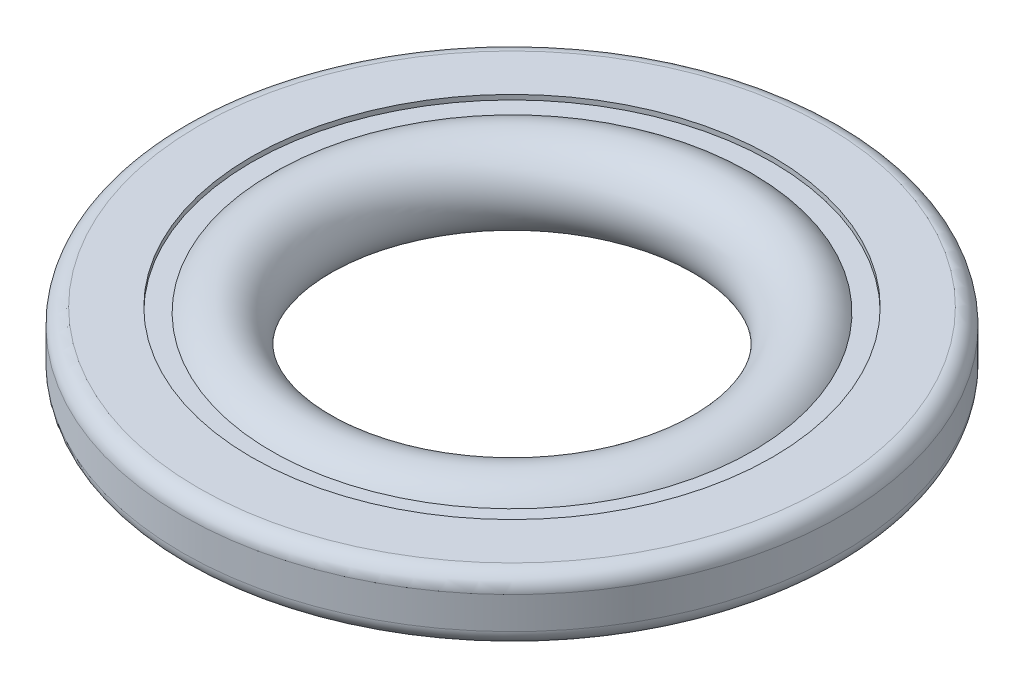
from build123d import *

# Parameters (mm, degrees)
FILLET1_R = 0.275


with BuildPart() as part:
    # Sketch2 → Revolve1 (revolve)
    with BuildSketch(Plane.XY):
        Polygon((-5.65, 0.55), (-4.463953488, 0.55), (-4.463953488, 0.4675), (-4.627906977, 0.4675), (-4.627906977, -0.4675), (-4.463953488, -0.4675), (-4.463953488, -0.55), (-5.65, -0.55), align=None)
    revolve(axis=Axis((0, 0, 0), (0, 1, 0)))

    # Fillet1
    fillet1_edges = [part.edges().sort_by_distance(p)[0] for p in [
        (5.65, 0.55, 0),
        (5.65, -0.55, 0),
    ]]
    fillet(fillet1_edges, radius=FILLET1_R)


with BuildPart() as body_2:
    # Sketch4 → Revolve2 (revolve)
    with BuildSketch(Plane.XY):
        with BuildLine():
            Line((-4.627906977, 0.4675), (-4.627906977, -0.4675))
            Line((-4.627906977, -0.4675), (-4.121002639, -0.4675))
            ThreePointArc((-4.121002639, -0.4675), (-2.9, 0), (-4.121002639, 0.4675))
            Line((-4.121002639, 0.4675), (-4.627906977, 0.4675))
        make_face()
    revolve(axis=Axis((0, 0, 0), (0, 1, 0)))


solid = Compound([part.part, body_2.part])
